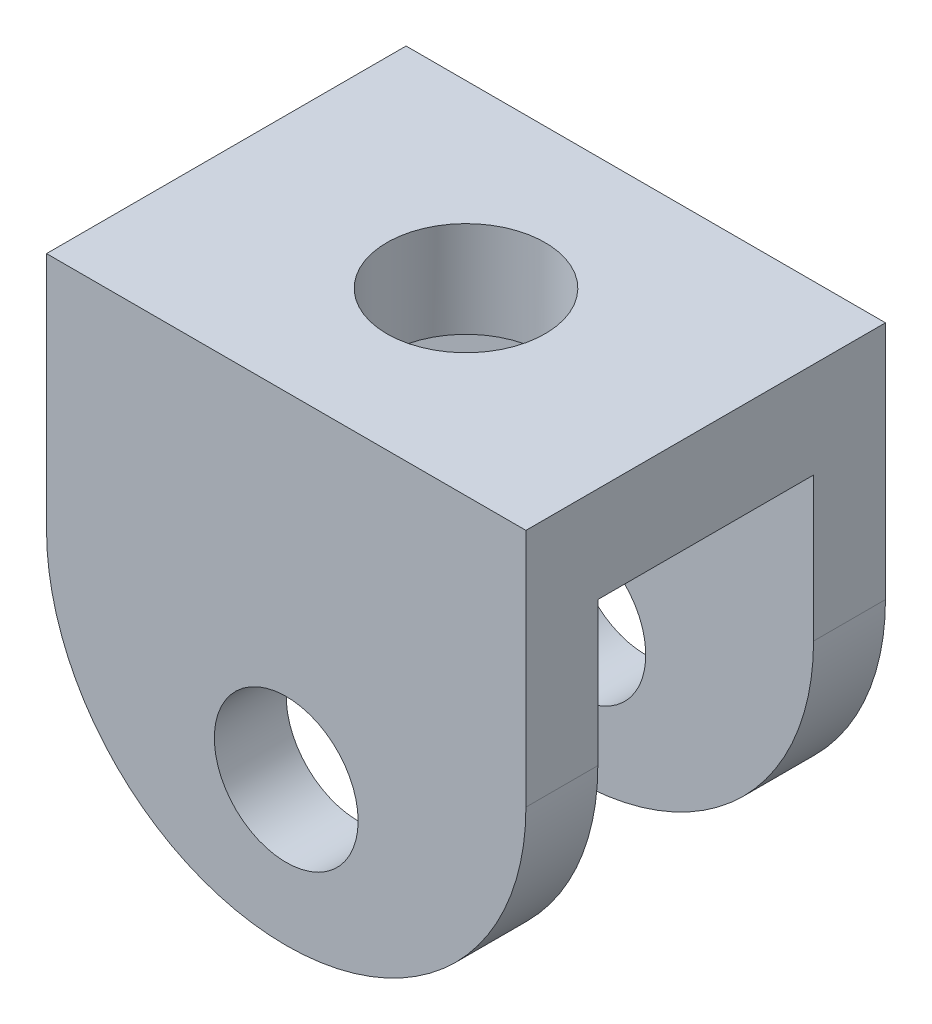
from build123d import *

# Parameters (mm, degrees)
SKETCH1_W                = 20
SKETCH1_H                = 15
BOSS_EXTRUDE1_DEPTH      = 4
SKETCH3_W                = 20
SKETCH3_H                = 3
BOSS_EXTRUDE2_DEPTH      = 16
M6_CLEARANCE_HOLE1_D     = 6.6
M6_CLEARANCE_HOLE1_DEPTH = 8
M6_CLEARANCE_HOLE1_TIP   = 1.982840043
SKETCH6_R                = 3
CUT_EXTRUDE1_DEPTH       = 15
FILLET1_R                = 10


with BuildPart() as part:
    # Sketch1 → Boss-Extrude1 (new body)
    with BuildSketch(Plane(origin=(0, 0, 0), x_dir=(1, 0, 0), z_dir=(0, 1, 0))):
        Rectangle(SKETCH1_W, SKETCH1_H)
    extrude(amount=BOSS_EXTRUDE1_DEPTH)

    # Sketch3 → Boss-Extrude2 (add)
    with BuildSketch(Plane.XZ):
        with Locations((0, -6)):
            Rectangle(SKETCH3_W, SKETCH3_H)
        with Locations((0, 6)):
            Rectangle(SKETCH3_W, SKETCH3_H)
    extrude(amount=BOSS_EXTRUDE2_DEPTH)

    # M6 Clearance Hole1
    with Locations(Plane.ZX.offset(4)):
        with Locations((0, 0)):
            Hole(M6_CLEARANCE_HOLE1_D / 2, depth=M6_CLEARANCE_HOLE1_DEPTH)
            with Locations((0, 0, -(M6_CLEARANCE_HOLE1_DEPTH + M6_CLEARANCE_HOLE1_TIP / 2))):  # 118° drill point
                Cone(0, M6_CLEARANCE_HOLE1_D / 2, M6_CLEARANCE_HOLE1_TIP, mode=Mode.SUBTRACT)

    # Sketch6 → Cut-Extrude1 (cut)
    with BuildSketch(Plane.XY.offset(-7.5)):
        with Locations((0, -10)):
            Circle(SKETCH6_R)
    extrude(amount=CUT_EXTRUDE1_DEPTH, mode=Mode.SUBTRACT)

    # Fillet1
    fillet1_edges = [part.edges().sort_by_distance(p)[0] for p in [
        (10, -16, -6),
        (10, -16, 6),
        (-10, -16, 6),
        (-10, -16, -6),
    ]]
    fillet(fillet1_edges, radius=FILLET1_R - 0.0001)  # a hair under: the kernel refuses the full size


solid = part.part
